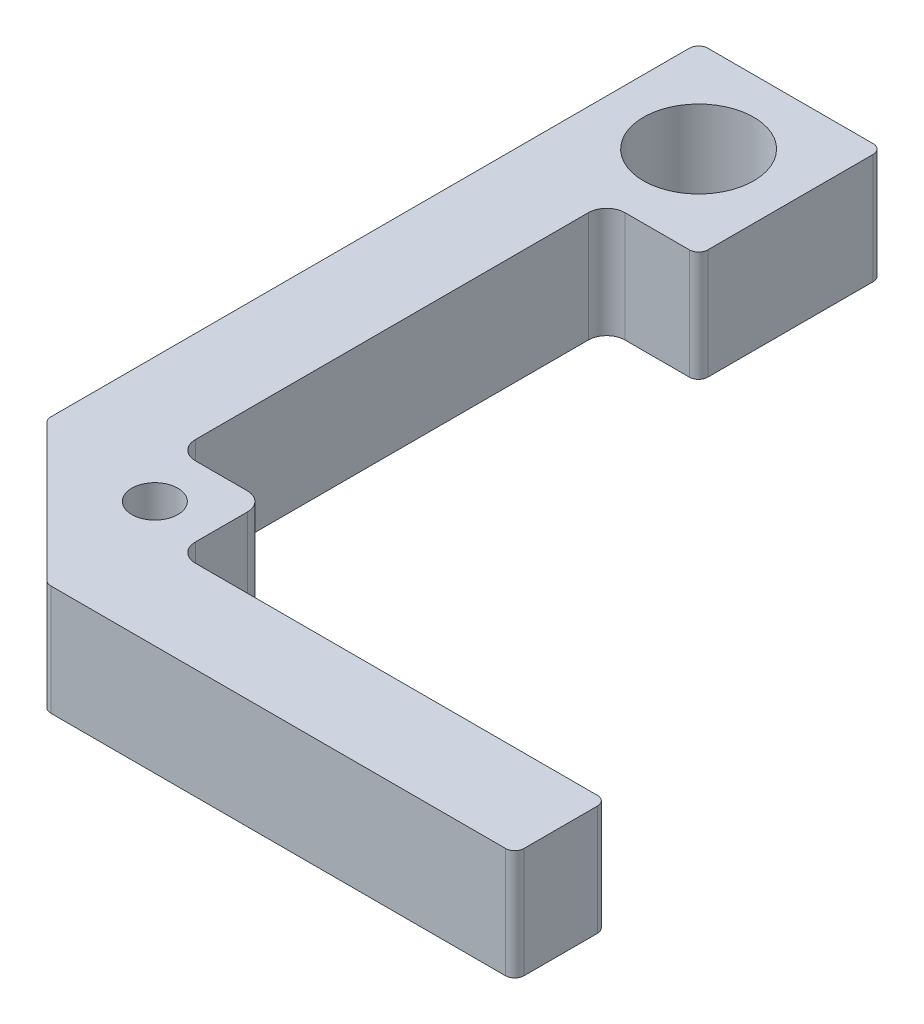
from build123d import *

# Parameters (mm, degrees)
SKETCH1_R               = 6
BOSS_EXTRUDE1_DEPTH     = 12
SKETCH3_W               = 9.65
SKETCH3_H               = 9.65
CUT_EXTRUDE1_DEPTH      = 1
SKETCH4_R               = 2.5
CUT_EXTRUDE2_DEPTH      = 110.521322125
FILLET_OUTER_STEPPER_R  = 2
FILLET_INNER_STEPPER_R  = 2
FILLET_OUTER_STEPPER2_R = 2
FILLET5_R               = 1


with BuildPart() as part:
    # Sketch1 → Boss-Extrude1 (new body)
    with BuildSketch(Plane(origin=(0, 0, 0), x_dir=(1, 0, 0), z_dir=(0, 1, 0))):
        Polygon((-66.4, 15.507864376), (-50.892135624, 0), (0, 0), (0, 10), (-46.75, 10), (-46.75, 19.65), (-56.4, 19.65), (-56.4, 66.4), (-46.4, 66.4), (-46.4, 86.4), (-66.4, 86.4), (-66.4, 66.4), align=None)
        with Locations((-56.4, 76.4)):
            Circle(SKETCH1_R, mode=Mode.SUBTRACT)
    extrude(amount=BOSS_EXTRUDE1_DEPTH)

    # Sketch3 → Cut-Extrude1 (cut)
    with BuildSketch(Plane.XZ):
        with Locations((-51.575, -14.825)):
            Rectangle(SKETCH3_W, SKETCH3_H)
    extrude(amount=-CUT_EXTRUDE1_DEPTH, mode=Mode.SUBTRACT)

    # Sketch4 → Cut-Extrude2 (cut, through all)
    with BuildSketch(Plane.XZ.offset(-1)):
        with Locations((-52.778679656, -13.621320344)):
            Circle(SKETCH4_R)
    extrude(amount=-CUT_EXTRUDE2_DEPTH, mode=Mode.SUBTRACT)

    # Fillet - Outer Stepper
    fillet_outer_stepper_edges = [part.edges().sort_by_distance(p)[0] for p in [
        (-56.4, 0.5, -10),
        (-56.4, 6, -66.4),
    ]]
    fillet(fillet_outer_stepper_edges, radius=FILLET_OUTER_STEPPER_R)

    # Fillet - Inner Stepper
    fillet_inner_stepper_edges = [part.edges().sort_by_distance(p)[0] for p in [
        (-46.75, 6.5, -19.65),
    ]]
    fillet(fillet_inner_stepper_edges, radius=FILLET_INNER_STEPPER_R)

    # Fillet - Outer Stepper2
    fillet_outer_stepper2_edges = [part.edges().sort_by_distance(p)[0] for p in [
        (-46.75, 6.5, -10),
        (-56.4, 6.5, -19.65),
    ]]
    fillet(fillet_outer_stepper2_edges, radius=FILLET_OUTER_STEPPER2_R)

    # Fillet5
    fillet5_edges = [part.edges().sort_by_distance(p)[0] for p in [
        (-66.4, 6, -86.4),
        (-46.4, 6, -86.4),
        (-46.4, 6, -66.4),
        (-66.4, 6, -15.507864376),
        (-50.892135624, 6, 0),
        (0, 6, 0),
        (0, 6, -10),
    ]]
    fillet(fillet5_edges, radius=FILLET5_R)


solid = part.part
